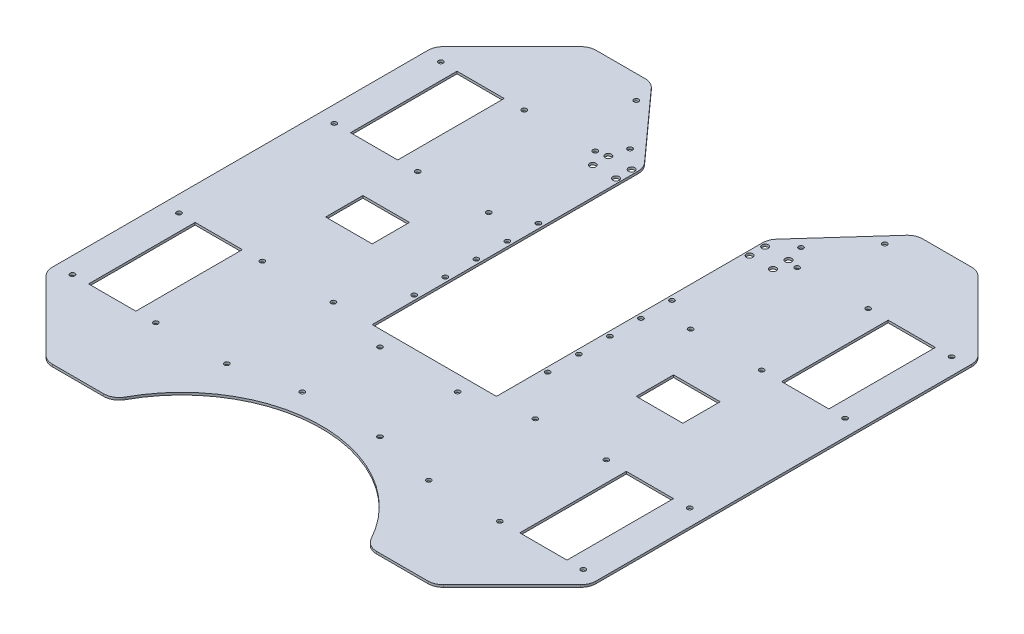
from build123d import *

# Parameters (mm, degrees)
SKETCH_1_R          = 1.55
SKETCH_1_R_2        = 2.05
SKETCH_1_W          = 30.4
SKETCH_1_H          = 68.58
EXTRUDE_1_DEPTH     = 1.5
FILLET_1_R          = 10
FILLET_2_R          = 10
FILLET_3_R          = 10
SKETCH_2_W          = 80
SKETCH_2_H          = 135
CUT_EXTRUDE_1_DEPTH = 10
SKETCH_3_W          = 30
SKETCH_3_H          = 24
CUT_EXTRUDE_2_DEPTH = 10
SKETCH_1_4_R        = 1.55
CUT_EXTRUDE_3_DEPTH = 10


with BuildPart() as part:
    # 草图1 → 凸台-拉伸1 (new body)
    with BuildSketch(Plane(origin=(0, 0, 0), x_dir=(1, 0, 0), z_dir=(0, 1, 0))):
        with BuildLine():
            Line((-125, 175), (-175, 125))
            Line((-175, 125), (-175, -125))
            Line((-175, -125), (-125, -175))
            Line((-125, -175), (-81.710313025, -175))
            ThreePointArc((-81.710313025, -175), (0, -122.728301649), (81.710313025, -175))
            Line((81.710313025, -175), (125, -175))
            Line((125, -175), (175, -125))
            Line((175, -125), (175, 125))
            Line((175, 125), (125, 175))
            Line((125, 175), (85, 175))
            Line((85, 175), (40, 125))
            Line((40, 125), (40, 85))
            Line((40, 85), (-40, 85))
            Line((-40, 85), (-40, 125))
            Line((-40, 125), (-85, 175))
            Line((-85, 175), (-125, 175))
        make_face()
        with Locations((-55, 131)):
            Circle(SKETCH_1_R, mode=Mode.SUBTRACT)
        with Locations((-80, 160)):
            Circle(SKETCH_1_R, mode=Mode.SUBTRACT)
        with Locations((55, 131)):
            Circle(SKETCH_1_R, mode=Mode.SUBTRACT)
        with Locations((80, 160)):
            Circle(SKETCH_1_R, mode=Mode.SUBTRACT)
        with Locations((-65, 118.58)):
            Circle(SKETCH_1_R, mode=Mode.SUBTRACT)
        with Locations((-65, 50)):
            Circle(SKETCH_1_R, mode=Mode.SUBTRACT)
        with Locations((-110.72, 50)):
            Circle(SKETCH_1_R, mode=Mode.SUBTRACT)
        with Locations((-110.72, 118.58)):
            Circle(SKETCH_1_R, mode=Mode.SUBTRACT)
        with Locations((-164.434, 118.58)):
            Circle(SKETCH_1_R, mode=Mode.SUBTRACT)
        with Locations((-164.434, 50)):
            Circle(SKETCH_1_R, mode=Mode.SUBTRACT)
        with Locations((-65, -118.58)):
            Circle(SKETCH_1_R, mode=Mode.SUBTRACT)
        with Locations((-65, -50)):
            Circle(SKETCH_1_R, mode=Mode.SUBTRACT)
        with Locations((-110.72, -50)):
            Circle(SKETCH_1_R, mode=Mode.SUBTRACT)
        with Locations((-110.72, -118.58)):
            Circle(SKETCH_1_R, mode=Mode.SUBTRACT)
        with Locations((-164.434, -50)):
            Circle(SKETCH_1_R, mode=Mode.SUBTRACT)
        with Locations((-164.434, -118.58)):
            Circle(SKETCH_1_R, mode=Mode.SUBTRACT)
        with Locations((65, 50)):
            Circle(SKETCH_1_R, mode=Mode.SUBTRACT)
        with Locations((110.72, 50)):
            Circle(SKETCH_1_R, mode=Mode.SUBTRACT)
        with Locations((110.72, 118.58)):
            Circle(SKETCH_1_R, mode=Mode.SUBTRACT)
        with Locations((65, 118.58)):
            Circle(SKETCH_1_R, mode=Mode.SUBTRACT)
        with Locations((164.434, 118.58)):
            Circle(SKETCH_1_R, mode=Mode.SUBTRACT)
        with Locations((164.434, 50)):
            Circle(SKETCH_1_R, mode=Mode.SUBTRACT)
        with Locations((164.434, -118.58)):
            Circle(SKETCH_1_R, mode=Mode.SUBTRACT)
        with Locations((164.434, -50)):
            Circle(SKETCH_1_R, mode=Mode.SUBTRACT)
        with Locations((110.72, -50)):
            Circle(SKETCH_1_R, mode=Mode.SUBTRACT)
        with Locations((110.72, -118.58)):
            Circle(SKETCH_1_R, mode=Mode.SUBTRACT)
        with Locations((65, -118.58)):
            Circle(SKETCH_1_R, mode=Mode.SUBTRACT)
        with Locations((65, -50)):
            Circle(SKETCH_1_R, mode=Mode.SUBTRACT)
        with Locations((25, -60)):
            Circle(SKETCH_1_R, mode=Mode.SUBTRACT)
        with Locations((25, -110)):
            Circle(SKETCH_1_R, mode=Mode.SUBTRACT)
        with Locations((-25, -60)):
            Circle(SKETCH_1_R, mode=Mode.SUBTRACT)
        with Locations((-25, -110)):
            Circle(SKETCH_1_R, mode=Mode.SUBTRACT)
        with Locations((-43, 120)):
            Circle(SKETCH_1_R_2, mode=Mode.SUBTRACT)
        with Locations((-43, 110)):
            Circle(SKETCH_1_R_2, mode=Mode.SUBTRACT)
        with Locations((-58, 110)):
            Circle(SKETCH_1_R_2, mode=Mode.SUBTRACT)
        with Locations((-58, 120)):
            Circle(SKETCH_1_R_2, mode=Mode.SUBTRACT)
        with Locations((43, 120)):
            Circle(SKETCH_1_R_2, mode=Mode.SUBTRACT)
        with Locations((58, 120)):
            Circle(SKETCH_1_R_2, mode=Mode.SUBTRACT)
        with Locations((58, 110)):
            Circle(SKETCH_1_R_2, mode=Mode.SUBTRACT)
        with Locations((43, 110)):
            Circle(SKETCH_1_R_2, mode=Mode.SUBTRACT)
        with Locations((-138.794, 84.29)):
            Rectangle(SKETCH_1_W, SKETCH_1_H, mode=Mode.SUBTRACT)
        with Locations((138.794, 84.29)):
            Rectangle(SKETCH_1_W, SKETCH_1_H, mode=Mode.SUBTRACT)
        with Locations((-138.794, -84.29)):
            Rectangle(SKETCH_1_W, SKETCH_1_H, mode=Mode.SUBTRACT)
        with Locations((138.794, -84.29)):
            Rectangle(SKETCH_1_W, SKETCH_1_H, mode=Mode.SUBTRACT)
    extrude(amount=EXTRUDE_1_DEPTH)

    # 圆角1
    fillet_1_edges = [part.edges().sort_by_distance(p)[0] for p in [
        (-40, 0.75, -125),
    ]]
    fillet(fillet_1_edges, radius=FILLET_1_R)

    # 圆角2
    fillet_2_edges = [part.edges().sort_by_distance(p)[0] for p in [
        (40, 0.75, -125),
    ]]
    fillet(fillet_2_edges, radius=FILLET_2_R)

    # 圆角3
    fillet_3_edges = [part.edges().sort_by_distance(p)[0] for p in [
        (-85, 0.75, -175),
        (85, 0.75, -175),
        (125, 0.75, -175),
        (175, 0.75, -125),
        (175, 0.75, 125),
        (125, 0.75, 175),
        (81.710313025, 0.75, 175),
        (-81.710313025, 0.75, 175),
        (-125, 0.75, 175),
        (-175, 0.75, 125),
        (-175, 0.75, -125),
        (-125, 0.75, -175),
    ]]
    fillet(fillet_3_edges, radius=FILLET_3_R)

    # 草图2 → 切除-拉伸1 (cut)
    with BuildSketch(Plane(origin=(0, 1.5, 0), x_dir=(1, 0, 0), z_dir=(0, 1, 0))):
        with Locations((0, 17.5)):
            Rectangle(SKETCH_2_W, SKETCH_2_H)
    extrude(amount=-CUT_EXTRUDE_1_DEPTH, mode=Mode.SUBTRACT)

    # 草图3 → 切除-拉伸2 (cut)
    with BuildSketch(Plane(origin=(0, 1.5, 0), x_dir=(1, 0, 0), z_dir=(0, 1, 0))):
        with Locations((-100, 7)):
            Rectangle(SKETCH_3_W, SKETCH_3_H)
        with Locations((100, 7)):
            Rectangle(SKETCH_3_W, SKETCH_3_H)
    extrude(amount=-CUT_EXTRUDE_2_DEPTH, mode=Mode.SUBTRACT)

    # 草图1<4> → 切除-拉伸3 (cut)
    with BuildSketch(Plane(origin=(0, 0, 0), x_dir=(1, 0, 0), z_dir=(0, 1, 0))):
        with Locations((43, -20)):
            Circle(SKETCH_1_4_R)
        with Locations((43, 0)):
            Circle(SKETCH_1_4_R)
        with Locations((43, 20)):
            Circle(SKETCH_1_4_R)
        with Locations((43, 40)):
            Circle(SKETCH_1_4_R)
        with Locations((43, 60)):
            Circle(SKETCH_1_4_R)
        with Locations((-43, -20)):
            Circle(SKETCH_1_4_R)
        with Locations((-43, 0)):
            Circle(SKETCH_1_4_R)
        with Locations((-43, 20)):
            Circle(SKETCH_1_4_R)
        with Locations((-43, 40)):
            Circle(SKETCH_1_4_R)
        with Locations((-43, 60)):
            Circle(SKETCH_1_4_R)
    extrude(amount=CUT_EXTRUDE_3_DEPTH, mode=Mode.SUBTRACT)


solid = part.part
